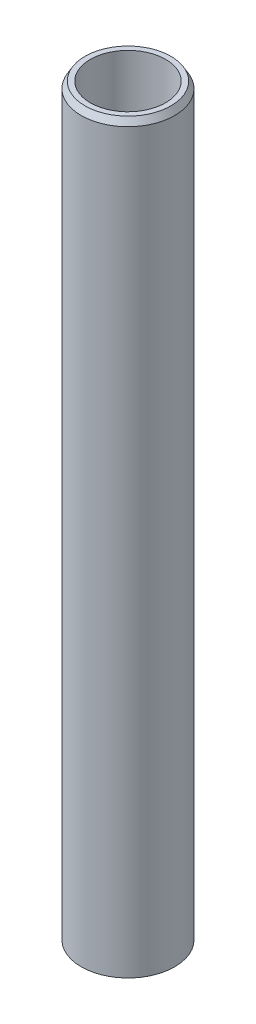
from build123d import *
from OCP.BRepFilletAPI import BRepFilletAPI_MakeChamfer

# Parameters (mm, degrees)
SKETCH1_R           = 37.5
BOSS_EXTRUDE1_DEPTH = 600
SKETCH2_R           = 30.219773562
CUT_EXTRUDE1_DEPTH  = 603.339190158
CHAMFER1_SIZE       = 5.228876025
CHAMFER1_SIZE2      = 3.01889298


with BuildPart() as part:
    # Sketch1 → Boss-Extrude1 (new body)
    with BuildSketch(Plane(origin=(0, 0, 0), x_dir=(1, 0, 0), z_dir=(0, 1, 0))):
        Circle(SKETCH1_R)
    extrude(amount=BOSS_EXTRUDE1_DEPTH)

    # Sketch2 → Cut-Extrude1 (cut, through all)
    with BuildSketch(Plane(origin=(0, 0, 0), x_dir=(1, 0, 0), z_dir=(0, 1, 0))):
        Circle(SKETCH2_R)
    extrude(amount=CUT_EXTRUDE1_DEPTH, mode=Mode.SUBTRACT)

    # Chamfer1: one chamfer whose edges measure the first distance from different faces: ONE call of the kernel's chamfer builder (chamfer() names one face for all edges)
    chamfer1_edges_1 = [part.edges().sort_by_distance(p)[0] for p in [
        (-37.5, 600, 0),
    ]]
    chamfer1_side_1 = [part.faces().sort_by_distance(p)[0] for p in [
        (-37.5, 300, 0),
    ]]
    chamfer1_edges_2 = [part.edges().sort_by_distance(p)[0] for p in [
        (-37.5, 0, 0),
    ]]
    chamfer1_side_2 = [part.faces().sort_by_distance(p)[0] for p in [
        (-36.439339828, 0, 0),
    ]]
    chamfer1 = BRepFilletAPI_MakeChamfer(part.part.solid().wrapped)
    for e in chamfer1_edges_1:
        chamfer1.Add(CHAMFER1_SIZE, CHAMFER1_SIZE2, e.wrapped, chamfer1_side_1[0].wrapped)  # the first distance lies on this face
    for e in chamfer1_edges_2:
        chamfer1.Add(CHAMFER1_SIZE, CHAMFER1_SIZE2, e.wrapped, chamfer1_side_2[0].wrapped)  # the first distance lies on this face
    add(Compound.cast(chamfer1.Shape()), mode=Mode.REPLACE)


solid = part.part
